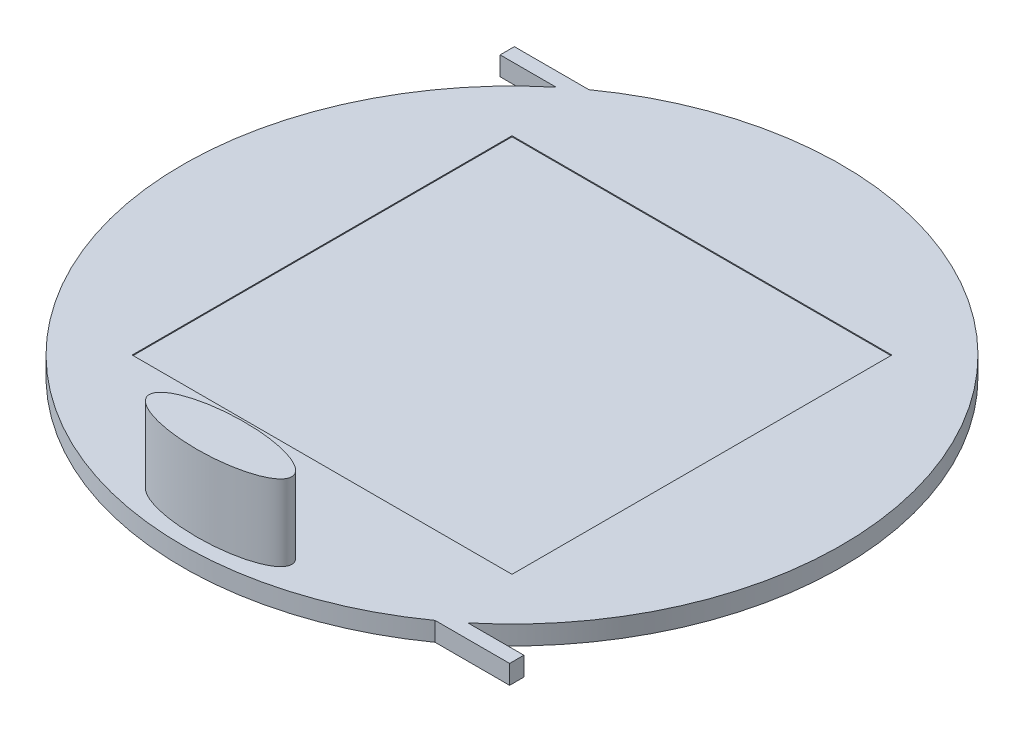
from build123d import *

# Parameters (mm, degrees)
BOSS_EXTRUDE1_DEPTH     = 2
SKETCH3_RX              = 7.5
SKETCH3_RY              = 2.5
BOSS_EXTRUDE2_DEPTH     = 8
SKETCH4_W               = 40
SKETCH4_H               = 40
CUT_EXTRUDE3_DEPTH      = 0.1
CUT_EXTRUDE4_DEPTH      = 22
CUT_EXTRUDE4_DEPTH_BACK = 21
SKETCH1_6_W             = 28
SKETCH1_6_H             = 1.5
EXTRUDE_THIN1_DEPTH     = 2


with BuildPart() as part:
    # Sketch1 → Boss-Extrude1 (new body)
    with BuildSketch(Plane(origin=(0, 0, 0), x_dir=(1, 0, 0), z_dir=(0, 1, 0))):
        with BuildLine():
            ThreePointArc((-21.162230506, 27.5), (-27.5, -21.162230506), (21.162230506, -27.5))
            ThreePointArc((21.162230506, -27.5), (27.5, 21.162230506), (-21.162230506, 27.5))
        make_face()
    extrude(amount=BOSS_EXTRUDE1_DEPTH)

    # Sketch3 → Boss-Extrude2 (add)
    with BuildSketch(Plane(origin=(0, 2, 0), x_dir=(1, 0, 0), z_dir=(0, 1, 0))):
        with Locations((0, -30.694699658)):
            Ellipse(SKETCH3_RX, SKETCH3_RY)
    extrude(amount=BOSS_EXTRUDE2_DEPTH)

    # Sketch4 → Cut-Extrude3 (cut)
    with BuildSketch(Plane(origin=(0, 2, 0), x_dir=(1, 0, 0), z_dir=(0, 1, 0))):
        Rectangle(SKETCH4_W, SKETCH4_H)
    extrude(amount=-CUT_EXTRUDE3_DEPTH, mode=Mode.SUBTRACT)

    # Sketch7 → Cut-Extrude4 (cut, two sides: drawn at the far end of the back side and taken through both)
    with BuildSketch(Plane.XY.offset(-CUT_EXTRUDE4_DEPTH_BACK)):
        Polygon((-34.7, 1), (-29.75, 0), (-34.7, 0), align=None)
    extrude(amount=CUT_EXTRUDE4_DEPTH + CUT_EXTRUDE4_DEPTH_BACK, mode=Mode.SUBTRACT)

    # Sketch1<6> → Extrude-Thin1 (add)
    with BuildSketch(Plane(origin=(0, 0, 0), x_dir=(1, 0, 0), z_dir=(0, 1, 0))):
        with Locations((-14, 27.5)):
            Rectangle(SKETCH1_6_W, SKETCH1_6_H)
        with Locations((14, -27.5)):
            Rectangle(SKETCH1_6_W, SKETCH1_6_H)
    extrude(amount=EXTRUDE_THIN1_DEPTH)


solid = part.part
